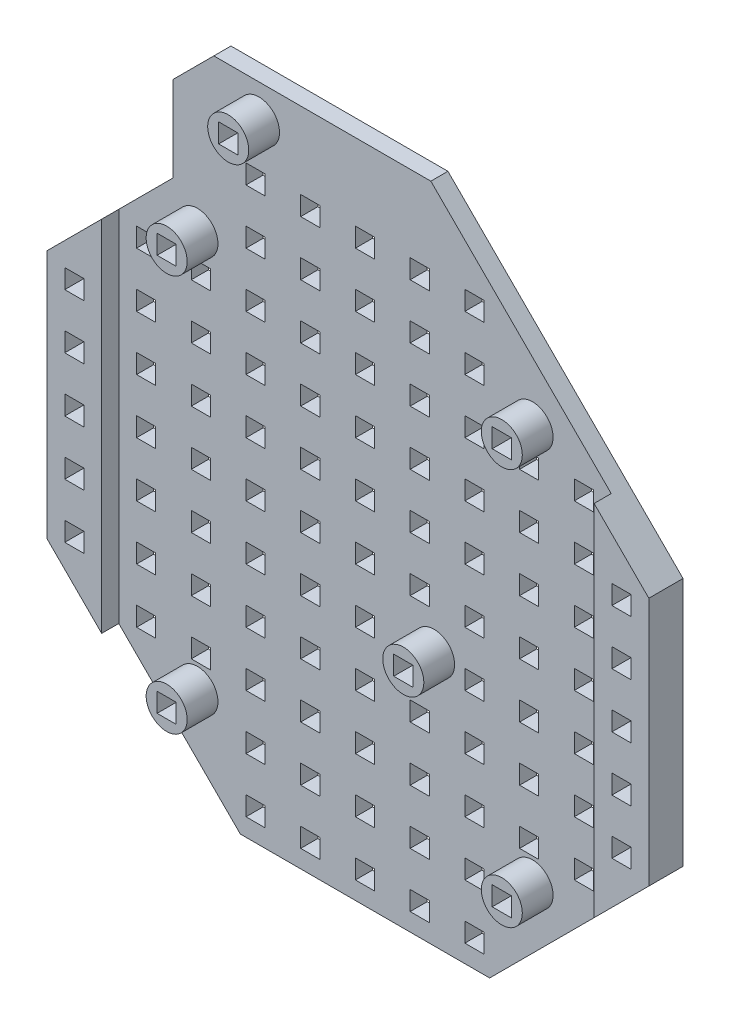
from build123d import *

# Parameters (mm, degrees)
RESSALTO_EXTRUS_O1_DEPTH  = 2.5
ESBO_O5_W                 = 2.8
ESBO_O5_H                 = 2.8
CORTE_EXTRUS_O2_DEPTH     = 90.837353033
ESBO_O7_W                 = 2.8
ESBO_O7_H                 = 2.8
CORTE_EXTRUS_O3_DEPTH     = 90.837353033
ESBO_O16_W                = 2.8
ESBO_O16_H                = 2.8
RESSALTO_EXTRUS_O6_DEPTH  = 1.5
CORTE_EXTRUS_O4_DEPTH     = 10
RESSALTO_EXTRUS_O7_DEPTH  = 2.5
ESBO_O20_W                = 2.8
ESBO_O20_H                = 2.8
CORTE_EXTRUS_O5_DEPTH     = 63.275597147
ESBO_O22_W                = 6.044359215
ESBO_O22_H                = 7.339579046
ESBO_O22_W_2              = 5.324792641
ESBO_O22_H_2              = 5.034634795
ESBO_O22_W_3              = 4.749139383
ESBO_O22_H_3              = 7.051752417
ESBO_O22_W_4              = 5.938634033
ESBO_O22_H_4              = 5.180879326
ESBO_O22_W_5              = 5.711055592
ESBO_O22_H_5              = 6.328467008
RESSALTO_EXTRUS_O8_DEPTH  = 2.5
RESSALTO_EXTRUS_O9_DEPTH  = 2.5
ESBO_O25_R                = 3
RESSALTO_EXTRUS_O10_DEPTH = 4.5
ESBO_O23_W                = 2.8
ESBO_O23_H                = 2.8
CORTE_EXTRUS_O6_DEPTH     = 69.93301096
CORTE_EXTRUS_O7_DEPTH     = 69.72415878
ESBO_O27_W                = 2.8
ESBO_O27_H                = 2.8
RESSALTO_EXTRUS_O11_DEPTH = 2.5


with BuildPart() as part:
    # Esboço1 → Ressalto-extrusão1 (new body)
    with BuildSketch(Plane.XY):
        Polygon((63.5, -26.302561211), (63.5, 26.302561211), (26.302561211, 63.5), (-26.302561211, 63.5), (-63.5, 26.302561211), (-63.5, -26.302561211), (-26.302561211, -63.5), (26.302561211, -63.5), align=None)
    extrude(amount=RESSALTO_EXTRUS_O1_DEPTH)

    # Esboço5 → Corte-extrusão2 (cut, through all)
    with BuildSketch(Plane.XY):
        Polygon((-47.72970773, -34.436100244), (-49.709606717, -36.415999231), (-47.72970773, -38.395898218), (-45.749808743, -36.415999231), align=None)
        Polygon((-42.072853481, -40.092954493), (-44.052752468, -42.072853481), (-42.072853481, -44.052752468), (-40.092954493, -42.072853481), align=None)
        Polygon((-53.38656198, -28.779245994), (-55.366460967, -30.759144982), (-53.38656198, -32.739043969), (-51.406662992, -30.759144982), align=None)
        Polygon((-60.9, 25.225605949), (-59.043416229, 27.082189719), (-57.063517242, 25.102290732), (-58.1, 24.065807974), (-58.1, 22.6), (-60.9, 22.6), align=None)
        with Locations((-59.5, 8)):
            Rectangle(ESBO_O5_W, ESBO_O5_H)
        with Locations((-59.5, 0)):
            Rectangle(ESBO_O5_W, ESBO_O5_H)
        Polygon((-25.225605949, -60.9), (-27.082189719, -59.043416229), (-25.102290732, -57.063517242), (-24.065807974, -58.1), (-22.6, -58.1), (-22.6, -60.9), align=None)
        Polygon((-30.759144982, -55.366460967), (-32.739043969, -53.38656198), (-30.759144982, -51.406662992), (-28.779245994, -53.38656198), align=None)
        Polygon((-36.415999231, -49.709606717), (-38.395898218, -47.72970773), (-36.415999231, -45.749808743), (-34.436100244, -47.72970773), align=None)
        with Locations((-8, -59.5)):
            Rectangle(ESBO_O5_W, ESBO_O5_H)
        with Locations((0, -59.5)):
            Rectangle(ESBO_O5_W, ESBO_O5_H)
        with Locations((-16, -59.5)):
            Rectangle(ESBO_O5_W, ESBO_O5_H)
        with Locations((-59.5, 16)):
            Rectangle(ESBO_O5_W, ESBO_O5_H)
        with Locations((-16, 8)):
            Rectangle(ESBO_O5_W, ESBO_O5_H)
        Polygon((-58.1, -24.065807974), (-57.063517242, -25.102290732), (-59.043416229, -27.082189719), (-60.9, -25.225605949), (-60.9, -22.6), (-58.1, -22.6), align=None)
        with Locations((-59.5, -16)):
            Rectangle(ESBO_O5_W, ESBO_O5_H)
        with Locations((-59.5, -8)):
            Rectangle(ESBO_O5_W, ESBO_O5_H)
        Polygon((25.225605949, 60.9), (27.082189719, 59.043416229), (25.102290732, 57.063517242), (24.065807974, 58.1), (22.6, 58.1), (22.6, 60.9), align=None)
        Polygon((24.065807974, -58.1), (25.102290732, -57.063517242), (27.082189719, -59.043416229), (25.225605949, -60.9), (22.6, -60.9), (22.6, -58.1), align=None)
        with Locations((8, 59.5)):
            Rectangle(ESBO_O5_W, ESBO_O5_H)
        with Locations((0, 59.5)):
            Rectangle(ESBO_O5_W, ESBO_O5_H)
        with Locations((16, -59.5)):
            Rectangle(ESBO_O5_W, ESBO_O5_H)
        with Locations((8, -59.5)):
            Rectangle(ESBO_O5_W, ESBO_O5_H)
        Polygon((34.436100244, -47.72970773), (36.415999231, -49.709606717), (38.395898218, -47.72970773), (36.415999231, -45.749808743), align=None)
        Polygon((40.092954493, -42.072853481), (42.072853481, -44.052752468), (44.052752468, -42.072853481), (42.072853481, -40.092954493), align=None)
        Polygon((28.779245994, -53.38656198), (30.759144982, -55.366460967), (32.739043969, -53.38656198), (30.759144982, -51.406662992), align=None)
        with Locations((16, 59.5)):
            Rectangle(ESBO_O5_W, ESBO_O5_H)
        Polygon((55.366460967, -30.759144982), (53.38656198, -32.739043969), (51.406662992, -30.759144982), (53.38656198, -28.779245994), align=None)
        Polygon((49.709606717, -36.415999231), (47.72970773, -38.395898218), (45.749808743, -36.415999231), (47.72970773, -34.436100244), align=None)
        Polygon((-24.065807974, 58.1), (-25.102290732, 57.063517242), (-27.082189719, 59.043416229), (-25.225605949, 60.9), (-22.6, 60.9), (-22.6, 58.1), align=None)
        with Locations((-16, 59.5)):
            Rectangle(ESBO_O5_W, ESBO_O5_H)
        with Locations((-8, 59.5)):
            Rectangle(ESBO_O5_W, ESBO_O5_H)
        Polygon((47.72970773, 34.436100244), (49.709606717, 36.415999231), (47.72970773, 38.395898218), (45.749808743, 36.415999231), align=None)
        Polygon((42.072853481, 40.092954493), (44.052752468, 42.072853481), (42.072853481, 44.052752468), (40.092954493, 42.072853481), align=None)
        Polygon((53.38656198, 28.779245994), (55.366460967, 30.759144982), (53.38656198, 32.739043969), (51.406662992, 30.759144982), align=None)
        Polygon((30.759144982, 55.366460967), (32.739043969, 53.38656198), (30.759144982, 51.406662992), (28.779245994, 53.38656198), align=None)
        Polygon((36.415999231, 49.709606717), (38.395898218, 47.72970773), (36.415999231, 45.749808743), (34.436100244, 47.72970773), align=None)
        Polygon((60.9, -25.225605949), (59.043416229, -27.082189719), (57.063517242, -25.102290732), (58.1, -24.065807974), (58.1, -22.6), (60.9, -22.6), align=None)
        with Locations((59.5, -8)):
            Rectangle(ESBO_O5_W, ESBO_O5_H)
        with Locations((59.5, 0)):
            Rectangle(ESBO_O5_W, ESBO_O5_H)
        with Locations((59.5, -16)):
            Rectangle(ESBO_O5_W, ESBO_O5_H)
        Polygon((58.1, 24.065807974), (57.063517242, 25.102290732), (59.043416229, 27.082189719), (60.9, 25.225605949), (60.9, 22.6), (58.1, 22.6), align=None)
        with Locations((59.5, 16)):
            Rectangle(ESBO_O5_W, ESBO_O5_H)
        with Locations((59.5, 8)):
            Rectangle(ESBO_O5_W, ESBO_O5_H)
        Polygon((-34.436100244, 47.72970773), (-36.415999231, 49.709606717), (-38.395898218, 47.72970773), (-36.415999231, 45.749808743), align=None)
        Polygon((-40.092954493, 42.072853481), (-42.072853481, 44.052752468), (-44.052752468, 42.072853481), (-42.072853481, 40.092954493), align=None)
        Polygon((-28.779245994, 53.38656198), (-30.759144982, 55.366460967), (-32.739043969, 53.38656198), (-30.759144982, 51.406662992), align=None)
        Polygon((-55.366460967, 30.759144982), (-53.38656198, 32.739043969), (-51.406662992, 30.759144982), (-53.38656198, 28.779245994), align=None)
        Polygon((-49.709606717, 36.415999231), (-47.72970773, 38.395898218), (-45.749808743, 36.415999231), (-47.72970773, 34.436100244), align=None)
        with Locations((-16, 0)):
            Rectangle(ESBO_O5_W, ESBO_O5_H)
        with Locations((16, 0)):
            Rectangle(ESBO_O5_W, ESBO_O5_H)
        with Locations((24, 0)):
            Rectangle(ESBO_O5_W, ESBO_O5_H)
        with Locations((-16, -8)):
            Rectangle(ESBO_O5_W, ESBO_O5_H)
        with Locations((16, 8)):
            Rectangle(ESBO_O5_W, ESBO_O5_H)
        with Locations((24, 8)):
            Rectangle(ESBO_O5_W, ESBO_O5_H)
        with Locations((24, 16)):
            Rectangle(ESBO_O5_W, ESBO_O5_H)
        with Locations((16, 24)):
            Rectangle(ESBO_O5_W, ESBO_O5_H)
        with Locations((24, 24)):
            Rectangle(ESBO_O5_W, ESBO_O5_H)
        with Locations((8, 32)):
            Rectangle(ESBO_O5_W, ESBO_O5_H)
        with Locations((16, 32)):
            Rectangle(ESBO_O5_W, ESBO_O5_H)
        with Locations((24, 32)):
            Rectangle(ESBO_O5_W, ESBO_O5_H)
        with Locations((32, 32)):
            Rectangle(ESBO_O5_W, ESBO_O5_H)
        with Locations((40, 32)):
            Rectangle(ESBO_O5_W, ESBO_O5_H)
        with Locations((8, 40)):
            Rectangle(ESBO_O5_W, ESBO_O5_H)
        with Locations((16, 40)):
            Rectangle(ESBO_O5_W, ESBO_O5_H)
        with Locations((24, 40)):
            Rectangle(ESBO_O5_W, ESBO_O5_H)
        with Locations((32, 40)):
            Rectangle(ESBO_O5_W, ESBO_O5_H)
        with Locations((8, 48)):
            Rectangle(ESBO_O5_W, ESBO_O5_H)
        with Locations((16, 48)):
            Rectangle(ESBO_O5_W, ESBO_O5_H)
        with Locations((24, 48)):
            Rectangle(ESBO_O5_W, ESBO_O5_H)
        with Locations((0, 24)):
            Rectangle(ESBO_O5_W, ESBO_O5_H)
        with Locations((0, 32)):
            Rectangle(ESBO_O5_W, ESBO_O5_H)
        with Locations((0, 40)):
            Rectangle(ESBO_O5_W, ESBO_O5_H)
        with Locations((0, 48)):
            Rectangle(ESBO_O5_W, ESBO_O5_H)
        with Locations((-24, 48)):
            Rectangle(ESBO_O5_W, ESBO_O5_H)
        with Locations((-16, 48)):
            Rectangle(ESBO_O5_W, ESBO_O5_H)
        with Locations((-8, 48)):
            Rectangle(ESBO_O5_W, ESBO_O5_H)
        with Locations((-32, 40)):
            Rectangle(ESBO_O5_W, ESBO_O5_H)
        with Locations((-24, 40)):
            Rectangle(ESBO_O5_W, ESBO_O5_H)
        with Locations((-16, 40)):
            Rectangle(ESBO_O5_W, ESBO_O5_H)
        with Locations((-8, 40)):
            Rectangle(ESBO_O5_W, ESBO_O5_H)
        with Locations((-40, 32)):
            Rectangle(ESBO_O5_W, ESBO_O5_H)
        with Locations((-32, 32)):
            Rectangle(ESBO_O5_W, ESBO_O5_H)
        with Locations((-24, 32)):
            Rectangle(ESBO_O5_W, ESBO_O5_H)
        with Locations((-16, 32)):
            Rectangle(ESBO_O5_W, ESBO_O5_H)
        with Locations((-8, 32)):
            Rectangle(ESBO_O5_W, ESBO_O5_H)
        with Locations((-24, 24)):
            Rectangle(ESBO_O5_W, ESBO_O5_H)
        with Locations((-16, 24)):
            Rectangle(ESBO_O5_W, ESBO_O5_H)
        with Locations((-24, 16)):
            Rectangle(ESBO_O5_W, ESBO_O5_H)
        with Locations((-24, 8)):
            Rectangle(ESBO_O5_W, ESBO_O5_H)
        with Locations((-24, 0)):
            Rectangle(ESBO_O5_W, ESBO_O5_H)
        with Locations((40, -32)):
            Rectangle(ESBO_O5_W, ESBO_O5_H)
        with Locations((-40, -32)):
            Rectangle(ESBO_O5_W, ESBO_O5_H)
        with Locations((-24, -8)):
            Rectangle(ESBO_O5_W, ESBO_O5_H)
        with Locations((-16, -16)):
            Rectangle(ESBO_O5_W, ESBO_O5_H)
        with Locations((-24, -16)):
            Rectangle(ESBO_O5_W, ESBO_O5_H)
        with Locations((-16, -24)):
            Rectangle(ESBO_O5_W, ESBO_O5_H)
        with Locations((-24, -24)):
            Rectangle(ESBO_O5_W, ESBO_O5_H)
        with Locations((-16, -32)):
            Rectangle(ESBO_O5_W, ESBO_O5_H)
        with Locations((-24, -32)):
            Rectangle(ESBO_O5_W, ESBO_O5_H)
        with Locations((-32, -32)):
            Rectangle(ESBO_O5_W, ESBO_O5_H)
        with Locations((-8, -40)):
            Rectangle(ESBO_O5_W, ESBO_O5_H)
        with Locations((-16, -40)):
            Rectangle(ESBO_O5_W, ESBO_O5_H)
        with Locations((-24, -40)):
            Rectangle(ESBO_O5_W, ESBO_O5_H)
        with Locations((-32, -40)):
            Rectangle(ESBO_O5_W, ESBO_O5_H)
        with Locations((-8, -48)):
            Rectangle(ESBO_O5_W, ESBO_O5_H)
        with Locations((-16, -48)):
            Rectangle(ESBO_O5_W, ESBO_O5_H)
        with Locations((-24, -48)):
            Rectangle(ESBO_O5_W, ESBO_O5_H)
        with Locations((0, -48)):
            Rectangle(ESBO_O5_W, ESBO_O5_H)
        with Locations((0, -40)):
            Rectangle(ESBO_O5_W, ESBO_O5_H)
        with Locations((24, -48)):
            Rectangle(ESBO_O5_W, ESBO_O5_H)
        with Locations((16, -48)):
            Rectangle(ESBO_O5_W, ESBO_O5_H)
        with Locations((8, -48)):
            Rectangle(ESBO_O5_W, ESBO_O5_H)
        with Locations((32, -40)):
            Rectangle(ESBO_O5_W, ESBO_O5_H)
        with Locations((24, -40)):
            Rectangle(ESBO_O5_W, ESBO_O5_H)
        with Locations((16, -40)):
            Rectangle(ESBO_O5_W, ESBO_O5_H)
        with Locations((8, -40)):
            Rectangle(ESBO_O5_W, ESBO_O5_H)
        with Locations((32, -32)):
            Rectangle(ESBO_O5_W, ESBO_O5_H)
        with Locations((24, -32)):
            Rectangle(ESBO_O5_W, ESBO_O5_H)
        with Locations((16, -32)):
            Rectangle(ESBO_O5_W, ESBO_O5_H)
        with Locations((24, -24)):
            Rectangle(ESBO_O5_W, ESBO_O5_H)
        with Locations((16, -24)):
            Rectangle(ESBO_O5_W, ESBO_O5_H)
        with Locations((24, -16)):
            Rectangle(ESBO_O5_W, ESBO_O5_H)
        with Locations((16, -16)):
            Rectangle(ESBO_O5_W, ESBO_O5_H)
        with Locations((24, -8)):
            Rectangle(ESBO_O5_W, ESBO_O5_H)
        with Locations((16, -8)):
            Rectangle(ESBO_O5_W, ESBO_O5_H)
    extrude(amount=CORTE_EXTRUS_O2_DEPTH, mode=Mode.SUBTRACT)

    # Esboço7 → Corte-extrusão3 (cut, through all)
    with BuildSketch(Plane(origin=(0, 0, 0), x_dir=(-1, 0, 0), z_dir=(0, 0, -1))):
        with Locations((-32, 8)):
            Rectangle(ESBO_O7_W, ESBO_O7_H)
        with Locations((40, 24)):
            Rectangle(ESBO_O7_W, ESBO_O7_H)
        with Locations((32, 24)):
            Rectangle(ESBO_O7_W, ESBO_O7_H)
        with Locations((48, 24)):
            Rectangle(ESBO_O7_W, ESBO_O7_H)
        with Locations((40, 16)):
            Rectangle(ESBO_O7_W, ESBO_O7_H)
        with Locations((48, 16)):
            Rectangle(ESBO_O7_W, ESBO_O7_H)
        with Locations((40, 8)):
            Rectangle(ESBO_O7_W, ESBO_O7_H)
        with Locations((48, 8)):
            Rectangle(ESBO_O7_W, ESBO_O7_H)
        with Locations((40, 0)):
            Rectangle(ESBO_O7_W, ESBO_O7_H)
        with Locations((48, 0)):
            Rectangle(ESBO_O7_W, ESBO_O7_H)
        with Locations((40, -8)):
            Rectangle(ESBO_O7_W, ESBO_O7_H)
        with Locations((48, -8)):
            Rectangle(ESBO_O7_W, ESBO_O7_H)
        with Locations((40, -16)):
            Rectangle(ESBO_O7_W, ESBO_O7_H)
        with Locations((48, -16)):
            Rectangle(ESBO_O7_W, ESBO_O7_H)
        with Locations((40, -24)):
            Rectangle(ESBO_O7_W, ESBO_O7_H)
        with Locations((48, -24)):
            Rectangle(ESBO_O7_W, ESBO_O7_H)
        with Locations((32, 16)):
            Rectangle(ESBO_O7_W, ESBO_O7_H)
        with Locations((32, 8)):
            Rectangle(ESBO_O7_W, ESBO_O7_H)
        with Locations((32, 0)):
            Rectangle(ESBO_O7_W, ESBO_O7_H)
        with Locations((32, -8)):
            Rectangle(ESBO_O7_W, ESBO_O7_H)
        with Locations((32, -16)):
            Rectangle(ESBO_O7_W, ESBO_O7_H)
        with Locations((32, -24)):
            Rectangle(ESBO_O7_W, ESBO_O7_H)
        with Locations((-32, 0)):
            Rectangle(ESBO_O7_W, ESBO_O7_H)
        with Locations((-32, -24)):
            Rectangle(ESBO_O7_W, ESBO_O7_H)
        with Locations((-32, -16)):
            Rectangle(ESBO_O7_W, ESBO_O7_H)
        with Locations((-32, -8)):
            Rectangle(ESBO_O7_W, ESBO_O7_H)
        with Locations((-32, 16)):
            Rectangle(ESBO_O7_W, ESBO_O7_H)
        with Locations((-48, -24)):
            Rectangle(ESBO_O7_W, ESBO_O7_H)
        with Locations((-40, -24)):
            Rectangle(ESBO_O7_W, ESBO_O7_H)
        with Locations((-48, -16)):
            Rectangle(ESBO_O7_W, ESBO_O7_H)
        with Locations((-40, -16)):
            Rectangle(ESBO_O7_W, ESBO_O7_H)
        with Locations((-48, -8)):
            Rectangle(ESBO_O7_W, ESBO_O7_H)
        with Locations((-40, -8)):
            Rectangle(ESBO_O7_W, ESBO_O7_H)
        with Locations((-48, 0)):
            Rectangle(ESBO_O7_W, ESBO_O7_H)
        with Locations((-40, 0)):
            Rectangle(ESBO_O7_W, ESBO_O7_H)
        with Locations((-48, 8)):
            Rectangle(ESBO_O7_W, ESBO_O7_H)
        with Locations((-40, 8)):
            Rectangle(ESBO_O7_W, ESBO_O7_H)
        with Locations((-48, 16)):
            Rectangle(ESBO_O7_W, ESBO_O7_H)
        with Locations((-40, 16)):
            Rectangle(ESBO_O7_W, ESBO_O7_H)
        with Locations((-48, 24)):
            Rectangle(ESBO_O7_W, ESBO_O7_H)
        with Locations((-40, 24)):
            Rectangle(ESBO_O7_W, ESBO_O7_H)
        with Locations((-32, 24)):
            Rectangle(ESBO_O7_W, ESBO_O7_H)
    extrude(amount=-CORTE_EXTRUS_O3_DEPTH, mode=Mode.SUBTRACT)

    # Esboço16 → Ressalto-extrusão6 (add)
    with BuildSketch(Plane.XY.offset(2.5)):
        Polygon((-26.302561211, -63.5), (26.302561211, -63.5), (63.5, -26.302561211), (63.5, 26.302561211), (26.302561211, 63.5), (-26.302561211, 63.5), (-63.5, 26.302561211), (-63.5, -26.302561211), align=None)
        Polygon((-47.72970773, -34.436100244), (-49.709606717, -36.415999231), (-47.72970773, -38.395898218), (-45.749808743, -36.415999231), align=None, mode=Mode.SUBTRACT)
        Polygon((-42.072853481, -40.092954493), (-44.052752468, -42.072853481), (-42.072853481, -44.052752468), (-40.092954493, -42.072853481), align=None, mode=Mode.SUBTRACT)
        Polygon((-53.38656198, -28.779245994), (-55.366460967, -30.759144982), (-53.38656198, -32.739043969), (-51.406662992, -30.759144982), align=None, mode=Mode.SUBTRACT)
        Polygon((-60.9, 25.225605949), (-59.043416229, 27.082189719), (-57.063517242, 25.102290732), (-58.1, 24.065807974), (-58.1, 22.6), (-60.9, 22.6), align=None, mode=Mode.SUBTRACT)
        with Locations((-59.5, 8)):
            Rectangle(ESBO_O16_W, ESBO_O16_H, mode=Mode.SUBTRACT)
        with Locations((-59.5, 0)):
            Rectangle(ESBO_O16_W, ESBO_O16_H, mode=Mode.SUBTRACT)
        Polygon((-25.225605949, -60.9), (-27.082189719, -59.043416229), (-25.102290732, -57.063517242), (-24.065807974, -58.1), (-22.6, -58.1), (-22.6, -60.9), align=None, mode=Mode.SUBTRACT)
        Polygon((-30.759144982, -55.366460967), (-32.739043969, -53.38656198), (-30.759144982, -51.406662992), (-28.779245994, -53.38656198), align=None, mode=Mode.SUBTRACT)
        Polygon((-36.415999231, -49.709606717), (-38.395898218, -47.72970773), (-36.415999231, -45.749808743), (-34.436100244, -47.72970773), align=None, mode=Mode.SUBTRACT)
        with Locations((-8, -59.5)):
            Rectangle(ESBO_O16_W, ESBO_O16_H, mode=Mode.SUBTRACT)
        with Locations((0, -59.5)):
            Rectangle(ESBO_O16_W, ESBO_O16_H, mode=Mode.SUBTRACT)
        with Locations((-16, -59.5)):
            Rectangle(ESBO_O16_W, ESBO_O16_H, mode=Mode.SUBTRACT)
        with Locations((-59.5, 16)):
            Rectangle(ESBO_O16_W, ESBO_O16_H, mode=Mode.SUBTRACT)
        Polygon((-58.1, -24.065807974), (-57.063517242, -25.102290732), (-59.043416229, -27.082189719), (-60.9, -25.225605949), (-60.9, -22.6), (-58.1, -22.6), align=None, mode=Mode.SUBTRACT)
        with Locations((-59.5, -16)):
            Rectangle(ESBO_O16_W, ESBO_O16_H, mode=Mode.SUBTRACT)
        with Locations((-59.5, -8)):
            Rectangle(ESBO_O16_W, ESBO_O16_H, mode=Mode.SUBTRACT)
        Polygon((25.225605949, 60.9), (27.082189719, 59.043416229), (25.102290732, 57.063517242), (24.065807974, 58.1), (22.6, 58.1), (22.6, 60.9), align=None, mode=Mode.SUBTRACT)
        Polygon((24.065807974, -58.1), (25.102290732, -57.063517242), (27.082189719, -59.043416229), (25.225605949, -60.9), (22.6, -60.9), (22.6, -58.1), align=None, mode=Mode.SUBTRACT)
        with Locations((8, 59.5)):
            Rectangle(ESBO_O16_W, ESBO_O16_H, mode=Mode.SUBTRACT)
        with Locations((0, 59.5)):
            Rectangle(ESBO_O16_W, ESBO_O16_H, mode=Mode.SUBTRACT)
        with Locations((16, -59.5)):
            Rectangle(ESBO_O16_W, ESBO_O16_H, mode=Mode.SUBTRACT)
        with Locations((8, -59.5)):
            Rectangle(ESBO_O16_W, ESBO_O16_H, mode=Mode.SUBTRACT)
        Polygon((34.436100244, -47.72970773), (36.415999231, -49.709606717), (38.395898218, -47.72970773), (36.415999231, -45.749808743), align=None, mode=Mode.SUBTRACT)
        Polygon((40.092954493, -42.072853481), (42.072853481, -44.052752468), (44.052752468, -42.072853481), (42.072853481, -40.092954493), align=None, mode=Mode.SUBTRACT)
        Polygon((28.779245994, -53.38656198), (30.759144982, -55.366460967), (32.739043969, -53.38656198), (30.759144982, -51.406662992), align=None, mode=Mode.SUBTRACT)
        with Locations((16, 59.5)):
            Rectangle(ESBO_O16_W, ESBO_O16_H, mode=Mode.SUBTRACT)
        Polygon((55.366460967, -30.759144982), (53.38656198, -32.739043969), (51.406662992, -30.759144982), (53.38656198, -28.779245994), align=None, mode=Mode.SUBTRACT)
        Polygon((49.709606717, -36.415999231), (47.72970773, -38.395898218), (45.749808743, -36.415999231), (47.72970773, -34.436100244), align=None, mode=Mode.SUBTRACT)
        Polygon((-24.065807974, 58.1), (-25.102290732, 57.063517242), (-27.082189719, 59.043416229), (-25.225605949, 60.9), (-22.6, 60.9), (-22.6, 58.1), align=None, mode=Mode.SUBTRACT)
        with Locations((-16, 59.5)):
            Rectangle(ESBO_O16_W, ESBO_O16_H, mode=Mode.SUBTRACT)
        with Locations((-8, 59.5)):
            Rectangle(ESBO_O16_W, ESBO_O16_H, mode=Mode.SUBTRACT)
        Polygon((47.72970773, 34.436100244), (49.709606717, 36.415999231), (47.72970773, 38.395898218), (45.749808743, 36.415999231), align=None, mode=Mode.SUBTRACT)
        Polygon((42.072853481, 40.092954493), (44.052752468, 42.072853481), (42.072853481, 44.052752468), (40.092954493, 42.072853481), align=None, mode=Mode.SUBTRACT)
        Polygon((53.38656198, 28.779245994), (55.366460967, 30.759144982), (53.38656198, 32.739043969), (51.406662992, 30.759144982), align=None, mode=Mode.SUBTRACT)
        Polygon((30.759144982, 55.366460967), (32.739043969, 53.38656198), (30.759144982, 51.406662992), (28.779245994, 53.38656198), align=None, mode=Mode.SUBTRACT)
        Polygon((36.415999231, 49.709606717), (38.395898218, 47.72970773), (36.415999231, 45.749808743), (34.436100244, 47.72970773), align=None, mode=Mode.SUBTRACT)
        Polygon((60.9, -25.225605949), (59.043416229, -27.082189719), (57.063517242, -25.102290732), (58.1, -24.065807974), (58.1, -22.6), (60.9, -22.6), align=None, mode=Mode.SUBTRACT)
        with Locations((59.5, -8)):
            Rectangle(ESBO_O16_W, ESBO_O16_H, mode=Mode.SUBTRACT)
        with Locations((59.5, 0)):
            Rectangle(ESBO_O16_W, ESBO_O16_H, mode=Mode.SUBTRACT)
        with Locations((59.5, -16)):
            Rectangle(ESBO_O16_W, ESBO_O16_H, mode=Mode.SUBTRACT)
        Polygon((58.1, 24.065807974), (57.063517242, 25.102290732), (59.043416229, 27.082189719), (60.9, 25.225605949), (60.9, 22.6), (58.1, 22.6), align=None, mode=Mode.SUBTRACT)
        with Locations((59.5, 16)):
            Rectangle(ESBO_O16_W, ESBO_O16_H, mode=Mode.SUBTRACT)
        with Locations((59.5, 8)):
            Rectangle(ESBO_O16_W, ESBO_O16_H, mode=Mode.SUBTRACT)
        Polygon((-34.436100244, 47.72970773), (-36.415999231, 49.709606717), (-38.395898218, 47.72970773), (-36.415999231, 45.749808743), align=None, mode=Mode.SUBTRACT)
        Polygon((-40.092954493, 42.072853481), (-42.072853481, 44.052752468), (-44.052752468, 42.072853481), (-42.072853481, 40.092954493), align=None, mode=Mode.SUBTRACT)
        Polygon((-28.779245994, 53.38656198), (-30.759144982, 55.366460967), (-32.739043969, 53.38656198), (-30.759144982, 51.406662992), align=None, mode=Mode.SUBTRACT)
        Polygon((-22.988852712, 55.5), (-55.5, 22.988852712), (-55.5, -22.988852712), (-22.988852712, -55.5), (22.988852712, -55.5), (55.5, -22.988852712), (55.5, 22.988852712), (22.988852712, 55.5), align=None, mode=Mode.SUBTRACT)
        Polygon((-55.366460967, 30.759144982), (-53.38656198, 32.739043969), (-51.406662992, 30.759144982), (-53.38656198, 28.779245994), align=None, mode=Mode.SUBTRACT)
        Polygon((-49.709606717, 36.415999231), (-47.72970773, 38.395898218), (-45.749808743, 36.415999231), (-47.72970773, 34.436100244), align=None, mode=Mode.SUBTRACT)
    extrude(amount=RESSALTO_EXTRUS_O6_DEPTH)

    # Esboço18 → Corte-extrusão4 (cut)
    with BuildSketch(Plane(origin=(0, 0, 0), x_dir=(-1, 0, 0), z_dir=(0, 0, -1))):
        Polygon((26.302561211, 63.5), (-26.302561211, 63.5), (-63.5, 26.302561211), (-63.5, -26.302561211), (-26.302561211, -63.5), (26.302561211, -63.5), (63.5, -26.302561211), (63.5, 26.302561211), align=None)
        Polygon((44, 18.225396744), (18.225396744, 44), (-18.225396744, 44), (-44, 18.225396744), (-44, -18.225396744), (-18.225396744, -44), (18.225396744, -44), (44, -18.225396744), align=None, mode=Mode.SUBTRACT)
    extrude(amount=-CORTE_EXTRUS_O4_DEPTH, mode=Mode.SUBTRACT)

    # Esboço19 → Ressalto-extrusão7 (add)
    with BuildSketch(Plane(origin=(0, 0, 0), x_dir=(-1, 0, 0), z_dir=(0, 0, -1))):
        Polygon((18.225396744, 44), (-18.225396744, 44), (-44, 18.225396744), (-44, -18.225396744), (-18.225396744, -44), (18.225396744, -44), (44, -18.225396744), (44, 18.225396744), align=None)
        Polygon((17.629299204, 42.560893234), (-17.629299204, 42.560893234), (-42.560893234, 17.629299204), (-42.560893234, -17.629299204), (-17.629299204, -42.560893234), (17.629299204, -42.560893234), (42.560893234, -17.629299204), (42.560893234, 17.629299204), align=None, mode=Mode.SUBTRACT)
    extrude(amount=-RESSALTO_EXTRUS_O7_DEPTH)

    # Esboço20 → Corte-extrusão5 (cut, through all)
    with BuildSketch(Plane(origin=(0, 0, 0), x_dir=(-1, 0, 0), z_dir=(0, 0, -1))):
        with Locations((-8, 16)):
            Rectangle(ESBO_O20_W, ESBO_O20_H)
        with Locations((-16, 16)):
            Rectangle(ESBO_O20_W, ESBO_O20_H)
        with Locations((-8, 24)):
            Rectangle(ESBO_O20_W, ESBO_O20_H)
        with Locations((-8, 8)):
            Rectangle(ESBO_O20_W, ESBO_O20_H)
        with Locations((-8, 0)):
            Rectangle(ESBO_O20_W, ESBO_O20_H)
        with Locations((-8, -8)):
            Rectangle(ESBO_O20_W, ESBO_O20_H)
        with Locations((-8, -16)):
            Rectangle(ESBO_O20_W, ESBO_O20_H)
        with Locations((-8, -24)):
            Rectangle(ESBO_O20_W, ESBO_O20_H)
        with Locations((-8, -32)):
            Rectangle(ESBO_O20_W, ESBO_O20_H)
        with Locations((0, 16)):
            Rectangle(ESBO_O20_W, ESBO_O20_H)
        with Locations((0, 8)):
            Rectangle(ESBO_O20_W, ESBO_O20_H)
        Rectangle(ESBO_O20_W, ESBO_O20_H)
        with Locations((0, -8)):
            Rectangle(ESBO_O20_W, ESBO_O20_H)
        with Locations((0, -16)):
            Rectangle(ESBO_O20_W, ESBO_O20_H)
        with Locations((0, -24)):
            Rectangle(ESBO_O20_W, ESBO_O20_H)
        with Locations((0, -32)):
            Rectangle(ESBO_O20_W, ESBO_O20_H)
        with Locations((8, -32)):
            Rectangle(ESBO_O20_W, ESBO_O20_H)
        with Locations((8, -24)):
            Rectangle(ESBO_O20_W, ESBO_O20_H)
        with Locations((8, -16)):
            Rectangle(ESBO_O20_W, ESBO_O20_H)
        with Locations((8, -8)):
            Rectangle(ESBO_O20_W, ESBO_O20_H)
        with Locations((8, 0)):
            Rectangle(ESBO_O20_W, ESBO_O20_H)
        with Locations((8, 8)):
            Rectangle(ESBO_O20_W, ESBO_O20_H)
        with Locations((8, 24)):
            Rectangle(ESBO_O20_W, ESBO_O20_H)
        with Locations((16, 16)):
            Rectangle(ESBO_O20_W, ESBO_O20_H)
        with Locations((8, 16)):
            Rectangle(ESBO_O20_W, ESBO_O20_H)
    extrude(amount=-CORTE_EXTRUS_O5_DEPTH, mode=Mode.SUBTRACT)

    # Esboço22 → Ressalto-extrusão8 (add)
    with BuildSketch(Plane.XY.offset(2.5)):
        with Locations((-23.400455052, 30.896585216)):
            Rectangle(ESBO_O22_W, ESBO_O22_H)
        with Locations((23.875068805, 31.617317398)):
            Rectangle(ESBO_O22_W_2, ESBO_O22_H_2)
        with Locations((-24.048064969, -30.698313447)):
            Rectangle(ESBO_O22_W_3, ESBO_O22_H_3)
        with Locations((23.030682984, -31.633749993)):
            Rectangle(ESBO_O22_W_4, ESBO_O22_H_4)
        with Locations((7.6454459, -7.789122843)):
            Rectangle(ESBO_O22_W_5, ESBO_O22_H_5)
    extrude(amount=-RESSALTO_EXTRUS_O8_DEPTH)

    # Esboço24 → Ressalto-extrusão9 (add)
    with BuildSketch(Plane.XY.offset(2.5)):
        Polygon((-28.1, 34.125396744), (-28.1, 52.6), (9.625396744, 52.6), (18.225396744, 44), (-18.225396744, 44), align=None)
    extrude(amount=-RESSALTO_EXTRUS_O9_DEPTH)

    # Esboço25 → Ressalto-extrusão10 (add)
    with BuildSketch(Plane.XY.offset(2.5)):
        with Locations((-24.5, -28.9)):
            Circle(ESBO_O25_R)
        with Locations((24.5, -28.9)):
            Circle(ESBO_O25_R)
        with Locations((24.5, 29.1)):
            Circle(ESBO_O25_R)
        with Locations((-24.5, 29.1)):
            Circle(ESBO_O25_R)
        with Locations((-15.5, 47.7)):
            Circle(ESBO_O25_R)
        with Locations((10.1, -6.9)):
            Circle(ESBO_O25_R)
    extrude(amount=RESSALTO_EXTRUS_O10_DEPTH)

    # Esboço23 → Corte-extrusão6 (cut, through all)
    with BuildSketch(Plane.XY):
        with Locations((-15.5, 47.7)):
            Rectangle(ESBO_O23_W, ESBO_O23_H)
        with Locations((10.1, -6.9)):
            Rectangle(ESBO_O23_W, ESBO_O23_H)
        with Locations((-24.5, 29.1)):
            Rectangle(ESBO_O23_W, ESBO_O23_H)
        with Locations((24.5, 29.1)):
            Rectangle(ESBO_O23_W, ESBO_O23_H)
        with Locations((-24.5, -28.9)):
            Rectangle(ESBO_O23_W, ESBO_O23_H)
        with Locations((24.5, -28.9)):
            Rectangle(ESBO_O23_W, ESBO_O23_H)
    extrude(amount=CORTE_EXTRUS_O6_DEPTH, mode=Mode.SUBTRACT)

    # Esboço26 → Corte-extrusão7 (cut, through all)
    with BuildSketch(Plane.XY.offset(2.5)):
        Polygon((-28.1, 52.6), (-22.1, 52.6), (-28.1, 46.6), align=None)
    extrude(amount=-CORTE_EXTRUS_O7_DEPTH, mode=Mode.SUBTRACT)

    # Esboço27 → Ressalto-extrusão11 (add)
    # profile 1 of 2: a face of its own
    with BuildSketch(Plane.XY.offset(2.5)):
        Polygon((-36, 18.225396744), (-36, 26.225396744), (-44, 18.225396744), (-44, -18.225396744), (-36, -26.225396744), (-36, -18.225396744), align=None)
        with Locations((-40, 16)):
            Rectangle(ESBO_O27_W, ESBO_O27_H, mode=Mode.SUBTRACT)
        with Locations((-40, 8)):
            Rectangle(ESBO_O27_W, ESBO_O27_H, mode=Mode.SUBTRACT)
        with Locations((-40, 0)):
            Rectangle(ESBO_O27_W, ESBO_O27_H, mode=Mode.SUBTRACT)
        with Locations((-40, -8)):
            Rectangle(ESBO_O27_W, ESBO_O27_H, mode=Mode.SUBTRACT)
        with Locations((-40, -16)):
            Rectangle(ESBO_O27_W, ESBO_O27_H, mode=Mode.SUBTRACT)
    # profile 2 of 2: a face of its own
    with BuildSketch(Plane.XY.offset(2.5)):
        Polygon((44, 18.225396744), (36, 26.225396744), (36, 18.225396744), (36, -18.225396744), (36, -26.225396744), (44, -18.225396744), align=None)
        with Locations((40, -16)):
            Rectangle(ESBO_O27_W, ESBO_O27_H, mode=Mode.SUBTRACT)
        with Locations((40, -8)):
            Rectangle(ESBO_O27_W, ESBO_O27_H, mode=Mode.SUBTRACT)
        with Locations((40, 0)):
            Rectangle(ESBO_O27_W, ESBO_O27_H, mode=Mode.SUBTRACT)
        with Locations((40, 8)):
            Rectangle(ESBO_O27_W, ESBO_O27_H, mode=Mode.SUBTRACT)
        with Locations((40, 16)):
            Rectangle(ESBO_O27_W, ESBO_O27_H, mode=Mode.SUBTRACT)
    extrude(amount=RESSALTO_EXTRUS_O11_DEPTH)


solid = part.part
